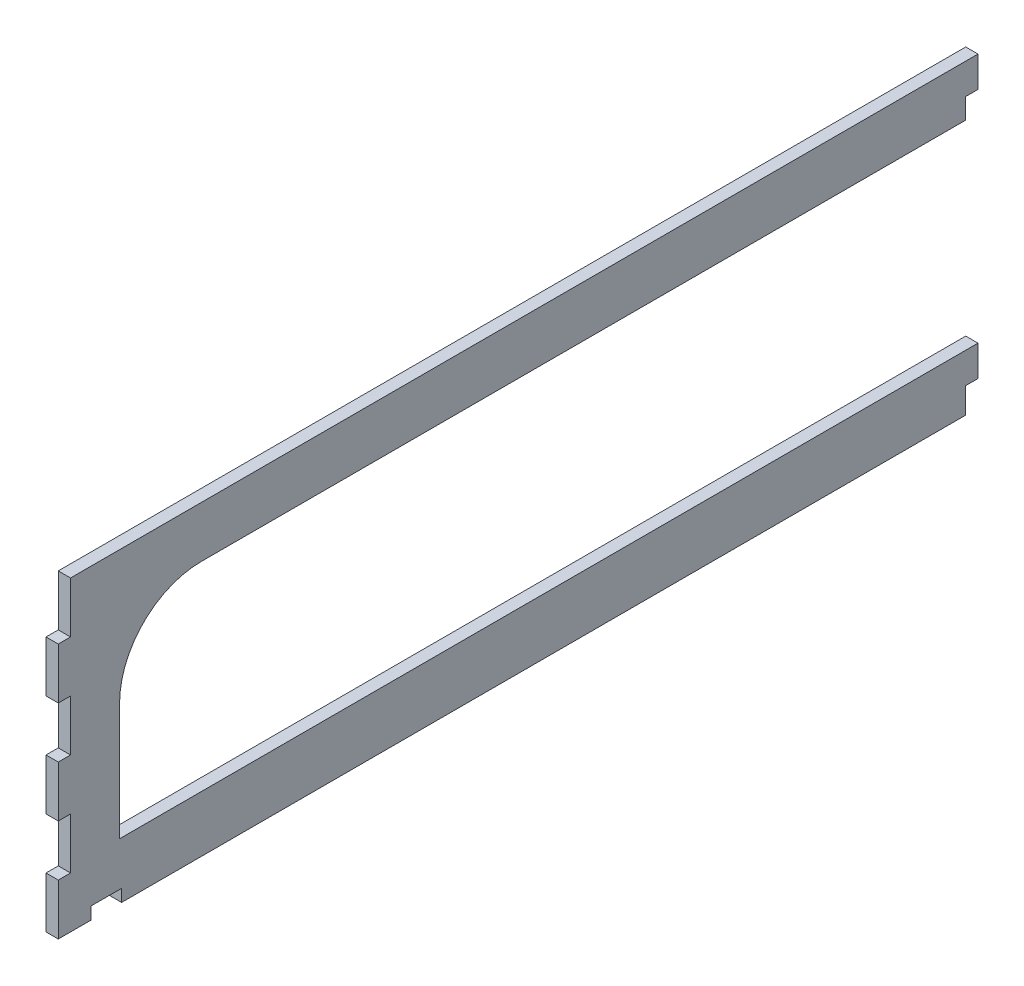
from build123d import *

# Parameters (mm, degrees)
BOSS_EXTRUDE1_DEPTH = 6
SKETCH2_W           = 6
SKETCH2_H           = 25
CUT_EXTRUDE1_DEPTH  = 6
LPATTERN1_COUNT     = 3
LPATTERN1_PITCH     = 50
FILLET1_R           = 40
SKETCH3_W           = 6
SKETCH3_H           = 10
SKETCH3_H_2         = 12.5
CUT_EXTRUDE2_DEPTH  = 475.379594839
SKETCH4_W           = 15
SKETCH4_H           = 6
CUT_EXTRUDE3_DEPTH  = 475.379594839


with BuildPart() as part:
    # Sketch1 → Boss-Extrude1 (new body)
    with BuildSketch(Plane(origin=(0, 0, 0), x_dir=(0, 0, -1), z_dir=(1, 0, 0))):
        Polygon((450, 125), (450, 150), (0, 150), (0, 0), (450, 0), (450, 27.5), (30, 27.5), (30, 125), align=None)
    extrude(amount=BOSS_EXTRUDE1_DEPTH)

    # Sketch2 → Cut-Extrude1 (cut)
    with BuildSketch(Plane(origin=(6, 0, 0), x_dir=(0, 0, -1), z_dir=(1, 0, 0))):
        with Locations((3, 137.5)):
            Rectangle(SKETCH2_W, SKETCH2_H)
    cut_extrude1 = extrude(amount=-CUT_EXTRUDE1_DEPTH, mode=Mode.SUBTRACT)

    # LPattern1: Cut-Extrude1 ×3
    with Locations(*[(0, -i * LPATTERN1_PITCH, 0) for i in range(1, LPATTERN1_COUNT)]):
        add(cut_extrude1, mode=Mode.SUBTRACT)

    # Fillet1
    fillet1_edges = [part.edges().sort_by_distance(p)[0] for p in [
        (3, 125, -30),
    ]]
    fillet(fillet1_edges, radius=FILLET1_R)

    # Sketch3 → Cut-Extrude2 (cut, through all)
    with BuildSketch(Plane.ZY):
        with Locations((-447, 130)):
            Rectangle(SKETCH3_W, SKETCH3_H)
        with Locations((-447, 6.25)):
            Rectangle(SKETCH3_W, SKETCH3_H_2)
    extrude(amount=-CUT_EXTRUDE2_DEPTH, mode=Mode.SUBTRACT)

    # Sketch4 → Cut-Extrude3 (cut, through all)
    with BuildSketch(Plane.ZY):
        with Locations((-23.5, 3)):
            Rectangle(SKETCH4_W, SKETCH4_H)
    extrude(amount=-CUT_EXTRUDE3_DEPTH, mode=Mode.SUBTRACT)


solid = part.part
